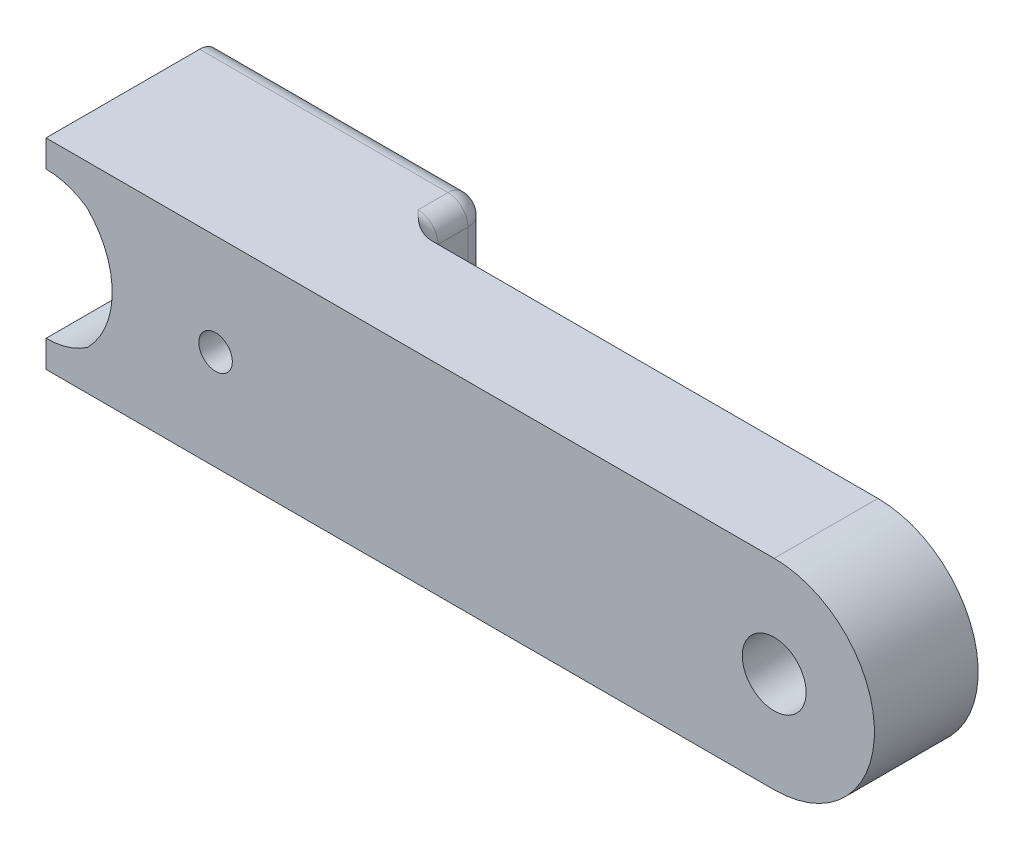
from build123d import *

# Parameters (mm, degrees)
EXTRUDE_1_DEPTH     = 2.2
SKETCH_2_W          = 36.5
SKETCH_2_H          = 10.05
EXTRUDE_2_DEPTH     = 3.25
SKETCH_3_W          = 36.5
SKETCH_3_H          = 10.05
EXTRUDE_3_DEPTH     = 3.25
CUT_EXTRUDE_1_DEPTH = 30
SKETCH_6_R          = 5.025
EXTRUDE_4_DEPTH     = 8.7
SKETCH_8_R          = 1.675
SKETCH_8_R_2        = 0.84
CUT_EXTRUDE_3_DEPTH = 55
SKETCH_9_W          = 53.416465659
SKETCH_9_H          = 14.532409192
CUT_EXTRUDE_4_DEPTH = 3.5
SKETCH_10_R         = 1.6
CUT_EXTRUDE_5_DEPTH = 10
CUT_EXTRUDE_6_DEPTH = 3.5
FILLET_1_R          = 1
FILLET_2_R          = 1
FILLET_3_R          = 1


with BuildPart() as part:
    # 草图1 → 凸台-拉伸1 (new body)
    with BuildSketch(Plane.XY):
        with BuildLine():
            Line((1.539836705, 12.851012384), (15.55297303, 14.251012384))
            ThreePointArc((15.55297303, 14.251012384), (17.193415997, 16.063512384), (15.55297303, 17.876012384))
            Line((15.55297303, 17.876012384), (1.500532553, 18.901012384))
            ThreePointArc((1.500532553, 18.901012384), (0.527100583, 19.384612538), (-0.54702697, 19.551012384))
            Line((-0.54702697, 19.551012384), (-0.54702697, 20.901012384))
            Line((-0.54702697, 20.901012384), (19.51277613, 20.901012384))
            Line((19.51277613, 20.901012384), (35.95297303, 20.901012384))
            Line((35.95297303, 20.901012384), (35.95297303, 10.851012384))
            Line((35.95297303, 10.851012384), (-0.54702697, 10.851012384))
            Line((-0.54702697, 10.851012384), (-0.54702697, 12.201012384))
            ThreePointArc((-0.54702697, 12.201012384), (0.54584768, 12.367273294), (1.539836705, 12.851012384))
        make_face()
    extrude(amount=EXTRUDE_1_DEPTH)

    # 草图2 → 凸台-拉伸2 (add)
    with BuildSketch(Plane(origin=(0, 0, 0), x_dir=(-1, 0, 0), z_dir=(0, 0, -1))):
        with Locations((-17.70297303, 15.876012384)):
            Rectangle(SKETCH_2_W, SKETCH_2_H)
    extrude(amount=EXTRUDE_2_DEPTH)

    # 草图3 → 凸台-拉伸3 (add)
    with BuildSketch(Plane.XY.offset(2.2)):
        with Locations((17.70297303, 15.876012384)):
            Rectangle(SKETCH_3_W, SKETCH_3_H)
    extrude(amount=EXTRUDE_3_DEPTH)

    # 草图4 → 切除-拉伸1 (cut, symmetric)
    with BuildSketch(Plane.XY):
        with BuildLine():
            Line((-0.54702697, 19.551012384), (-2.235397712, 16.616091152))
            Line((-2.235397712, 16.616091152), (-1.110896638, 12.310548833))
            Line((-1.110896638, 12.310548833), (-0.54702697, 12.201012384))
            ThreePointArc((-0.54702697, 12.201012384), (0.54584768, 12.367273294), (1.539836705, 12.851012384))
            ThreePointArc((1.539836705, 12.851012384), (2.773180655, 15.88415254), (1.500532553, 18.901012384))
            ThreePointArc((1.500532553, 18.901012384), (0.527100583, 19.384612538), (-0.54702697, 19.551012384))
        make_face()
    extrude(amount=CUT_EXTRUDE_1_DEPTH, both=True, mode=Mode.SUBTRACT)

    # 草图6 → 凸台-拉伸4 (add)
    with BuildSketch(Plane(origin=(0, 0, -3.25), x_dir=(-1, 0, 0), z_dir=(0, 0, -1))):
        with Locations((-35.95297303, 15.876012384)):
            Circle(SKETCH_6_R)
    extrude(amount=-EXTRUDE_4_DEPTH)

    # 草图8 → 切除-拉伸3 (cut)
    with BuildSketch(Plane(origin=(0, 0, -3.25), x_dir=(-1, 0, 0), z_dir=(0, 0, -1))):
        with Locations((-49.45297303, 15.876012384)):
            Circle(SKETCH_8_R)
        with Locations(Location((-7.95297303, 15.856360308, 0), (0, 0, 180))):
            Circle(SKETCH_8_R_2)
    extrude(amount=-CUT_EXTRUDE_3_DEPTH, mode=Mode.SUBTRACT)

    # 草图9 → 切除-拉伸4 (cut)
    with BuildSketch(Plane(origin=(0, 0, -3.25), x_dir=(-1, 0, 0), z_dir=(0, 0, -1))):
        with Locations((-39.607660409, 15.039406696)):
            Rectangle(SKETCH_9_W, SKETCH_9_H)
    extrude(amount=-CUT_EXTRUDE_4_DEPTH, mode=Mode.SUBTRACT)

    # 草图10 → 切除-拉伸5 (cut)
    with BuildSketch(Plane.XY.offset(5.45)):
        with Locations((35.95297303, 15.876012384)):
            Circle(SKETCH_10_R)
    extrude(amount=-CUT_EXTRUDE_5_DEPTH, mode=Mode.SUBTRACT)

    # 草图11 → 切除-拉伸6 (cut)
    with BuildSketch(Plane(origin=(0, 0, -3.25), x_dir=(-1, 0, 0), z_dir=(0, 0, -1))):
        Polygon((-12.89942758, 13.294850275), (0.782882432, 10.851012384), (0, 8.730799831), (-15.448021962, 9.415407398), align=None)
    extrude(amount=-CUT_EXTRUDE_6_DEPTH, mode=Mode.SUBTRACT)

    # 圆角1
    fillet_1_edges = [part.edges().sort_by_distance(p)[0] for p in [
        (12.89942758, 20.901012384, -1.5),
        (12.89942758, 13.294850275, -1.5),
        (6.176200305, 12.093994751, -3.25),
        (12.89942758, 17.09793133, -3.25),
        (6.176200305, 20.901012384, -3.25),
    ]]
    fillet(fillet_1_edges, radius=FILLET_1_R)

    # 圆角2
    # the kernel refuses this fillet: 1 mm, written as the material it adds along each edge
    with BuildSketch(Plane(origin=(11.89942758, 14.132063378, 0.25), x_dir=(0.17583025935665297, -0.9844204995298362, 0), z_dir=(-0.9844204995298362, -0.17583025935665297, 0))) as fillet_2_piece_1_section:
        with BuildLine():
            CenterArc((1 + FILLET_2_R, -FILLET_2_R), FILLET_2_R, 90, 90)
            Line((1, -FILLET_2_R), (1, 0))
            Line((1, 0), (1 + FILLET_2_R, 0))
        make_face()
    fillet_2_piece_1 = revolve(axis=Axis((11.89942758, 14.132063378, 0.25), (0, 0, 1)), revolution_arc=214.681339144, mode=Mode.PRIVATE)
    fillet_2_piece_1 = split(fillet_2_piece_1, bisect_by=Plane(origin=(12.386461292, 13.934658048, 0.148039327), z_dir=(0.0994113635758644, -0.9950464214256476, 0)), keep=Keep.TOP, mode=Mode.PRIVATE)
    add(fillet_2_piece_1)
    with BuildSketch(Plane(origin=(11.89942758, 14.132063378, 0.25), x_dir=(0.17583025935665297, -0.9844204995298362, 0), z_dir=(-0.9844204995298362, -0.17583025935665297, 0))) as fillet_2_piece_2_section:
        with BuildLine():
            CenterArc((1 + FILLET_2_R, -FILLET_2_R), FILLET_2_R, 90, 90)
            Line((1, -FILLET_2_R), (1, 0))
            Line((1, 0), (1 + FILLET_2_R, 0))
        make_face()
    fillet_2_piece_2 = revolve(axis=Axis((11.89942758, 14.132063378, 0.25), (0, 0, 1)), revolution_arc=214.681339144, mode=Mode.PRIVATE)
    fillet_2_piece_2 = split(fillet_2_piece_2, bisect_by=Plane(origin=(12.896125684, 14.022775497, 0), z_dir=(0, 0, -1)), keep=Keep.TOP, mode=Mode.PRIVATE)
    add(fillet_2_piece_2)
    with BuildSketch(Plane(origin=(12.07525784, 13.147642879, 0.25), x_dir=(0, 0, -1), z_dir=(-0.984420499529836, -0.17583025935665386, 0))) as fillet_2_piece_3_section:
        with BuildLine():
            CenterArc((FILLET_2_R, FILLET_2_R), FILLET_2_R, 180, 90)
            Line((0, FILLET_2_R), (0, 0))
            Line((0, 0), (FILLET_2_R, 0))
        make_face()
    fillet_2_piece_3 = extrude(amount=15.32204588, mode=Mode.PRIVATE)
    fillet_2_piece_3 = split(fillet_2_piece_3, bisect_by=Plane(origin=(-0.54702697, 11.899303342, 0.017148227), z_dir=(1, 0, 0)), keep=Keep.TOP, mode=Mode.PRIVATE)
    fillet_2_piece_3 = split(fillet_2_piece_3, bisect_by=Plane(origin=(6.26358972, 10.851012384, 0.017148227), z_dir=(0, 1, 0)), keep=Keep.TOP, mode=Mode.PRIVATE)
    add(fillet_2_piece_3)
    with BuildSketch(Plane(origin=(11.89942758, 19.901012384, 0.25), x_dir=(-0.5976672776328282, -0.8017442392976477, 0), z_dir=(0.8017442392976477, -0.5976672776328282, 0))) as fillet_2_piece_4_section:
        with BuildLine():
            CenterArc((1 + FILLET_2_R, FILLET_2_R), FILLET_2_R, 180, 90)
            Line((1 + FILLET_2_R, 0), (1, 0))
            Line((1, 0), (1, FILLET_2_R))
        make_face()
    fillet_2_piece_4 = revolve(axis=Axis((11.89942758, 19.901012384, 0.25), (0, 0, -1)), revolution_arc=233.296989237, mode=Mode.PRIVATE)
    fillet_2_piece_4 = split(fillet_2_piece_4, bisect_by=Plane(origin=(12.649366525, 20.901012384, -0.061628308), z_dir=(0, -1, 0)), keep=Keep.TOP, mode=Mode.PRIVATE)
    add(fillet_2_piece_4)
    with BuildSketch(Plane(origin=(12.89942758, 15.56956482, 0.25), x_dir=(0, 0, -1), z_dir=(0, 1, 0))) as fillet_2_piece_5_section:
        with BuildLine():
            CenterArc((FILLET_2_R, -FILLET_2_R), FILLET_2_R, 90, 90)
            Line((0, -FILLET_2_R), (0, 0))
            Line((0, 0), (FILLET_2_R, 0))
        make_face()
    fillet_2_piece_5 = extrude(amount=4.331447564, mode=Mode.PRIVATE)
    fillet_2_piece_5 = split(fillet_2_piece_5, bisect_by=Plane(origin=(12.930705697, 18.067283361, -0.180311335), z_dir=(0.0727477998867751, 0.9973503685323598, 0)), keep=Keep.TOP, mode=Mode.PRIVATE)
    add(fillet_2_piece_5)

    # 圆角3
    fillet_3_edges = [part.edges().sort_by_distance(p)[0] for p in [
        (2.773180655, 15.88415254, 0),
        (2.773180655, 15.88415254, 2.2),
    ]]
    fillet(fillet_3_edges, radius=FILLET_3_R)


solid = part.part
